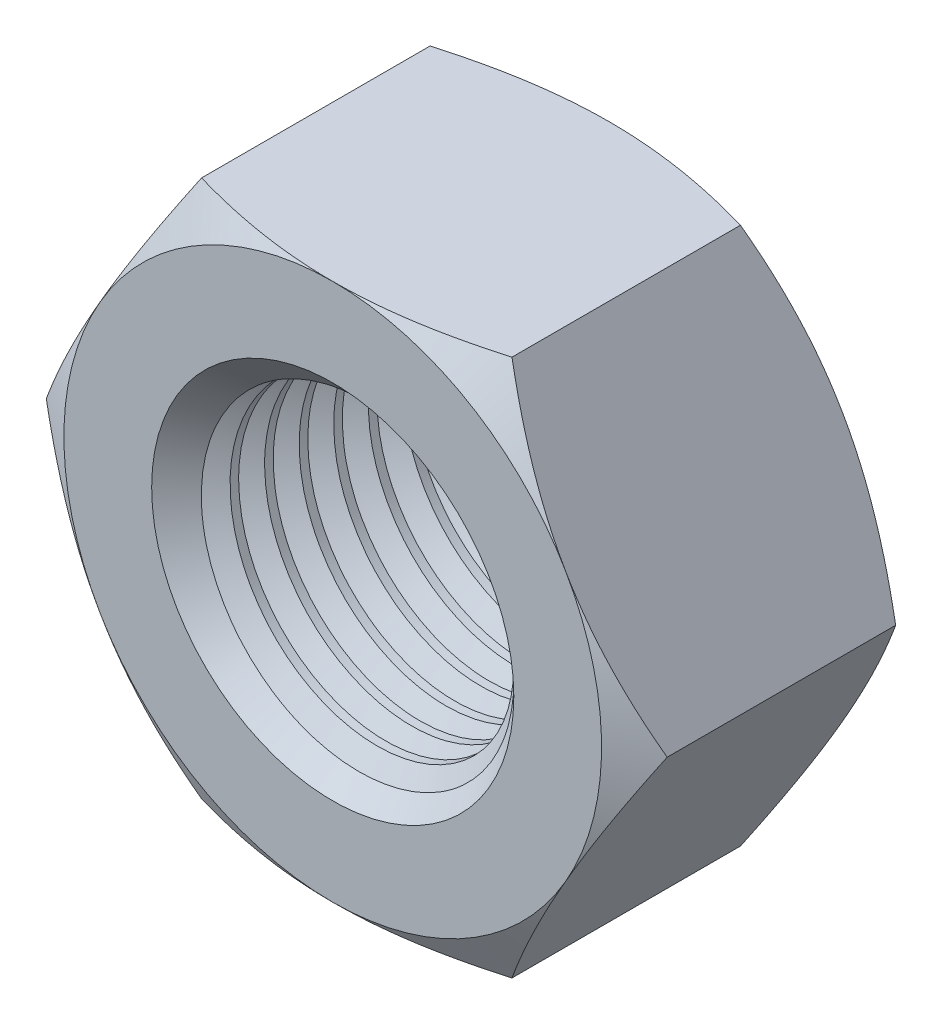
from build123d import *

# Parameters (mm, degrees)
Y_KSEKLIK_EKSTR_ZYON1_DEPTH = 36
IZIM2_OUTSIDE_W             = 230.102
IZIM2_OUTSIDE_H             = 219.27199999999996
IZIM2_OUTSIDE_R             = 35.00000000000001
KES_EKSTR_ZYON1_DEPTH       = 36
KES_EKSTR_ZYON1_DRAFT       = -60.000000000000135
IZIM3_OUTSIDE_W             = 230.102
IZIM3_OUTSIDE_H             = 219.27199999999996
IZIM3_OUTSIDE_R             = 35.00000000000001
KES_EKSTR_ZYON2_DEPTH       = 36
KES_EKSTR_ZYON2_DRAFT       = -60.000000000000135
IZIM4_R                     = 19.575
KES_EKSTR_ZYON3_DEPTH       = 36
PAH1_SIZE                   = 4
KES_S_P_R1_PITCH            = 4.5
KES_S_P_R1_HEIGHT           = 40
KES_S_P_R1_RADIUS           = 19.575


with BuildPart() as part:
    # Çizim1 → Yükseklik-Ekstrüzyon1 (new body)
    with BuildSketch(Plane.XY):
        Polygon((40.414518843273804, 9.8e-15), (20.207259421636888, 35), (-20.2072594216369, 35), (-40.41451884327381, 4.5e-16), (-20.20725942163689, -35), (20.20725942163689, -35), align=None)
    extrude(amount=Y_KSEKLIK_EKSTR_ZYON1_DEPTH)


with BuildPart() as kes_ekstr_zyon1_tool:
    # Çizim2 outside → Kes-Ekstrüzyon1 (with draft: the straight prism first)
    with BuildSketch(Plane.XY.offset(36)):
        Rectangle(IZIM2_OUTSIDE_W, IZIM2_OUTSIDE_H)
        Circle(IZIM2_OUTSIDE_R, mode=Mode.SUBTRACT)
    extrude(amount=-KES_EKSTR_ZYON1_DEPTH)
    # Kes-Ekstrüzyon1: the draft: its side faces are tilted about the plane it starts from
    kes_ekstr_zyon1_sides = [kes_ekstr_zyon1_tool.faces().sort_by_distance(p)[0] for p in [
        (0, -109.636, 18),
        (115.051, 0, 18),
        (0, 109.636, 18),
        (-115.051, 0, 18),
        (-35, 0, 18),
    ]]
    draft(kes_ekstr_zyon1_sides, Plane.XY.offset(36), KES_EKSTR_ZYON1_DRAFT)


with BuildPart() as part_1:
    add(part.part)

    # Kes-Ekstrüzyon1: cut by kes_ekstr_zyon1_tool
    add(kes_ekstr_zyon1_tool.part, mode=Mode.SUBTRACT)


with BuildPart() as kes_ekstr_zyon2_tool:
    # Çizim3 outside → Kes-Ekstrüzyon2 (with draft: the straight prism first)
    with BuildSketch(Plane(origin=(0, 0, 0), x_dir=(-1, 0, 0), z_dir=(0, 0, -1))):
        Rectangle(IZIM3_OUTSIDE_W, IZIM3_OUTSIDE_H)
        Circle(IZIM3_OUTSIDE_R, mode=Mode.SUBTRACT)
    extrude(amount=-KES_EKSTR_ZYON2_DEPTH)
    # Kes-Ekstrüzyon2: the draft: its side faces are tilted about the plane it starts from
    kes_ekstr_zyon2_sides = [kes_ekstr_zyon2_tool.faces().sort_by_distance(p)[0] for p in [
        (0, -109.636, 18),
        (-115.051, 0, 18),
        (0, 109.636, 18),
        (115.051, 0, 18),
        (35, 0, 18),
    ]]
    draft(kes_ekstr_zyon2_sides, Plane(origin=(0, 0, 0), x_dir=(-1, 0, 0), z_dir=(0, 0, -1)), KES_EKSTR_ZYON2_DRAFT)


with BuildPart() as part_2:
    add(part_1.part)

    # Kes-Ekstrüzyon2: cut by kes_ekstr_zyon2_tool
    add(kes_ekstr_zyon2_tool.part, mode=Mode.SUBTRACT)

    # Çizim4 → Kes-Ekstrüzyon3 (cut)
    with BuildSketch(Plane(origin=(0, 0, 0), x_dir=(-1, 0, 0), z_dir=(0, 0, -1))):
        Circle(IZIM4_R)
    extrude(amount=-KES_EKSTR_ZYON3_DEPTH, mode=Mode.SUBTRACT)

    # Pah1
    pah1_edges = [part_2.edges().sort_by_distance(p)[0] for p in [
        (19.575, 2.4e-15, 36),
        (19.575, 2.4e-15, 0),
    ]]
    chamfer(pah1_edges, length=PAH1_SIZE)

    # Kes-Süpür1: sweep along a helix
    with BuildLine() as kes_s_p_r1_path:
        Helix(KES_S_P_R1_PITCH, KES_S_P_R1_HEIGHT, KES_S_P_R1_RADIUS, center=(0, 0, 36), direction=(0, 0, -1))
    # Çizim6 → Kes-Süpür1 (sweep, cut)
    with BuildSketch(Plane(origin=(-14.99531997405554, -12.58256745961243, -3.9999999999998725), x_dir=(0.7664048803534041, 0.6416264064526197, -0.030644965543821196), z_dir=(-0.6423578125705987, 0.7655322308621554, -0.036562879272936645))):
        Polygon((0.965087461132385, 2.245943042855971), (0.9650874611323851, -2.2459430428559717), (-2.9250000000000007, 0), align=None)
    sweep(path=kes_s_p_r1_path.line, is_frenet=True, mode=Mode.SUBTRACT)


solid = part_2.part
